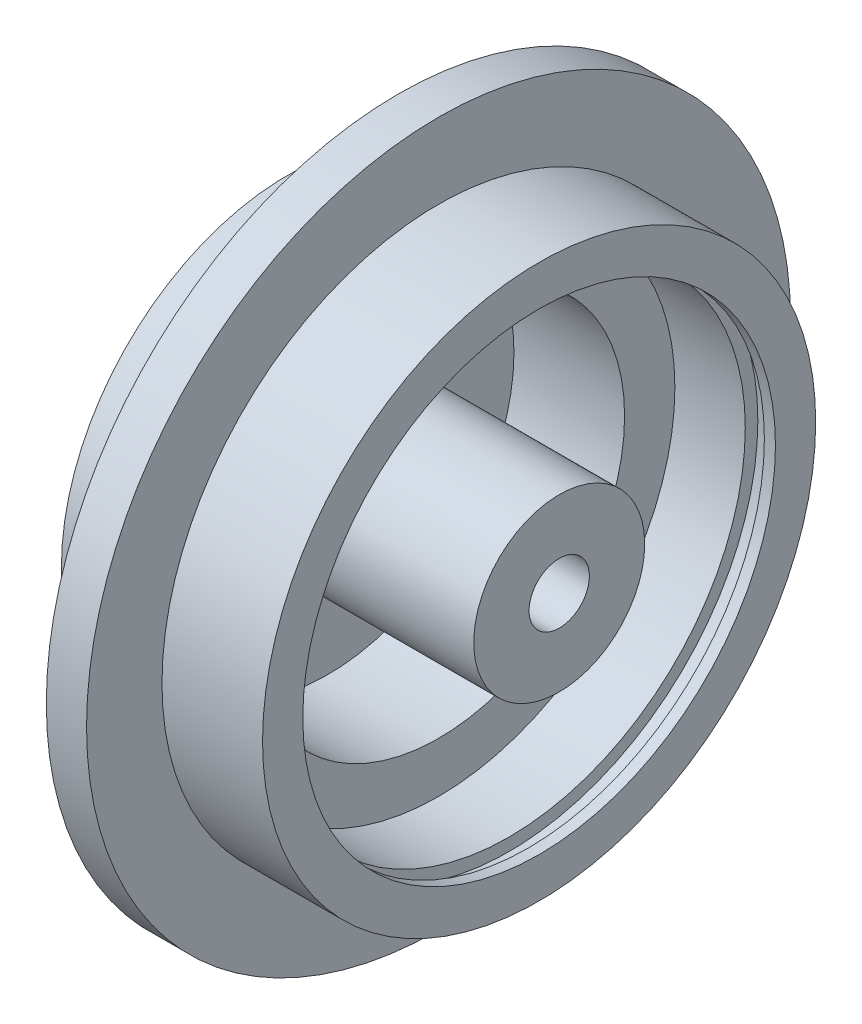
from build123d import *

# Parameters (mm, degrees)
SKETCH1_R           = 35
BOSS_EXTRUDE1_DEPTH = 27
CUT_EXTRUDE1_REACH  = 58.383
SKETCH2_R           = 3
SKETCH3_R           = 18.5
SKETCH3_R_2         = 8.5
CUT_EXTRUDE2_DEPTH  = 23
SKETCH4_R           = 23.5
SKETCH4_R_2         = 18.5
CUT_EXTRUDE5_DEPTH  = 12
SKETCH6_R           = 35.033277319
SKETCH6_R_2         = 22.5
CUT_EXTRUDE6_DEPTH  = 11
CUT_EXTRUDE7_START  = -12
SKETCH7_R           = 35
SKETCH7_R_2         = 27.5
CUT_EXTRUDE7_DEPTH  = 12
SKETCH8_R           = 35
SKETCH8_R_2         = 8.5
CUT_EXTRUDE8_DEPTH  = 2
SKETCH9_R           = 24.75
SKETCH9_R_2         = 8.5
CUT_EXTRUDE13_DEPTH = 0.95


with BuildPart() as part:
    # Sketch1 → Boss-Extrude1 (new body)
    with BuildSketch(Plane(origin=(0, 0, 0), x_dir=(0, 0, -1), z_dir=(1, 0, 0))):
        Circle(SKETCH1_R)
    extrude(amount=BOSS_EXTRUDE1_DEPTH)

    # Sketch2 → Cut-Extrude1 (cut, up to next)
    with BuildSketch(Plane.ZY, mode=Mode.PRIVATE) as cut_extrude1_sk1:
        Circle(SKETCH2_R)
    cut_extrude1_tool1 = extrude(cut_extrude1_sk1.sketch, amount=-CUT_EXTRUDE1_REACH, mode=Mode.PRIVATE) & part.part
    add(cut_extrude1_tool1.solids().sort_by_distance((0, 0, 0))[0], mode=Mode.SUBTRACT)

    # Sketch3 → Cut-Extrude2 (cut)
    with BuildSketch(Plane(origin=(27, 0, 0), x_dir=(0, 0, -1), z_dir=(1, 0, 0))):
        Circle(SKETCH3_R)
        Circle(SKETCH3_R_2, mode=Mode.SUBTRACT)
    extrude(amount=-CUT_EXTRUDE2_DEPTH, mode=Mode.SUBTRACT)

    # Sketch4 → Cut-Extrude5 (cut)
    with BuildSketch(Plane(origin=(27, 0, 0), x_dir=(0, 0, -1), z_dir=(1, 0, 0))):
        Circle(SKETCH4_R)
        Circle(SKETCH4_R_2, mode=Mode.SUBTRACT)
    extrude(amount=-CUT_EXTRUDE5_DEPTH, mode=Mode.SUBTRACT)

    # Sketch6 → Cut-Extrude6 (cut)
    with BuildSketch(Plane.ZY):
        Circle(SKETCH6_R)
        Circle(SKETCH6_R_2, mode=Mode.SUBTRACT)
    extrude(amount=-CUT_EXTRUDE6_DEPTH, mode=Mode.SUBTRACT)

    # Sketch7 → Cut-Extrude7 (cut)
    with BuildSketch(Plane(origin=(27, 0, 0), x_dir=(0, 0, -1), z_dir=(1, 0, 0)).offset(CUT_EXTRUDE7_START)):
        Circle(SKETCH7_R)
        Circle(SKETCH7_R_2, mode=Mode.SUBTRACT)
    extrude(amount=CUT_EXTRUDE7_DEPTH, mode=Mode.SUBTRACT)

    # Sketch8 → Cut-Extrude8 (cut)
    with BuildSketch(Plane(origin=(27, 0, 0), x_dir=(0, 0, -1), z_dir=(1, 0, 0))):
        Circle(SKETCH8_R)
        Circle(SKETCH8_R_2, mode=Mode.SUBTRACT)
    extrude(amount=-CUT_EXTRUDE8_DEPTH, mode=Mode.SUBTRACT)

    # Sketch9 → Cut-Extrude13 (cut, symmetric)
    with BuildSketch(Plane(origin=(22.95, 0, 0), x_dir=(0, 0, -1), z_dir=(1, 0, 0))):
        Circle(SKETCH9_R)
        Circle(SKETCH9_R_2, mode=Mode.SUBTRACT)
    extrude(amount=CUT_EXTRUDE13_DEPTH, both=True, mode=Mode.SUBTRACT)


solid = part.part
